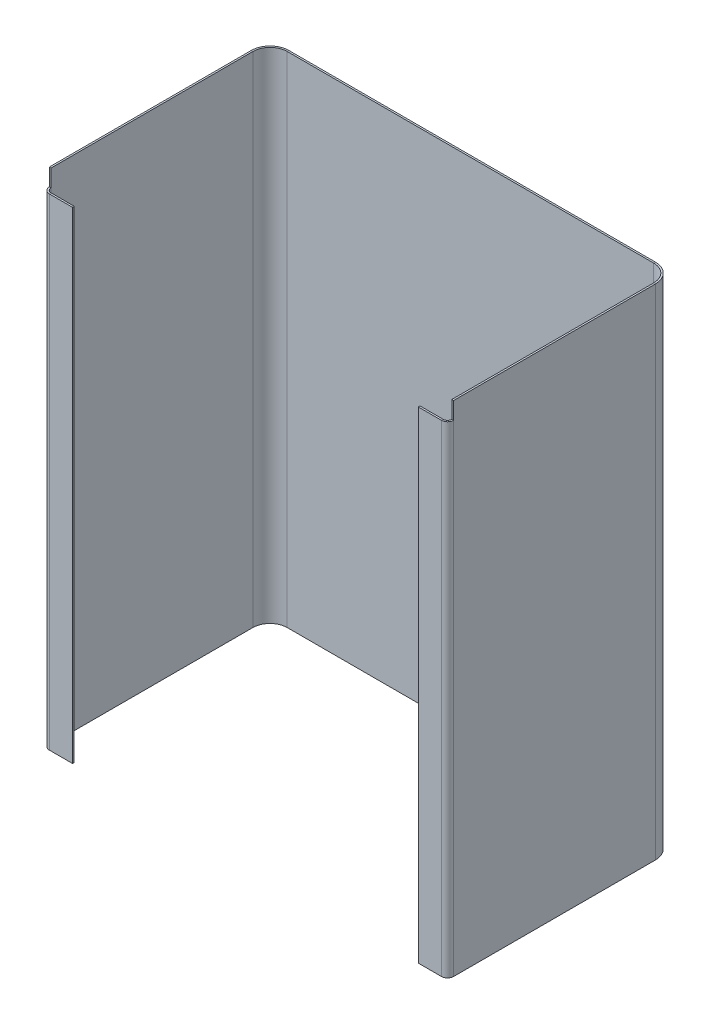
from build123d import *

# Parameters (mm, degrees)
SKETCH1_W                      = 235
SKETCH1_H                      = 1
BASE_FLANGE1_DEPTH             = 145
EDGE_FLANGE2_STRIP_W           = 24
EDGE_FLANGE2_STRIP_H           = 1
EDGE_FLANGE2_STRIP_CUT_DEPTH   = 290
EDGE_FLANGE2_STRIP_2_W         = 24
EDGE_FLANGE2_STRIP_2_H         = 1
EDGE_FLANGE2_STRIP_CUT_2_DEPTH = 290
EDGE_FLANGE2_DEPTH             = 290
EDGE_FLANGE2_BEND_DEPTH        = 290
EDGE_FLANGE3_STRIP_W           = 9
EDGE_FLANGE3_STRIP_H           = 1
EDGE_FLANGE3_STRIP_CUT_DEPTH   = 290
EDGE_FLANGE3_STRIP_2_W         = 9
EDGE_FLANGE3_STRIP_2_H         = 1
EDGE_FLANGE3_STRIP_CUT_2_DEPTH = 290
EDGE_FLANGE3_DEPTH             = 290
EDGE_FLANGE3_BEND_DEPTH        = 290
CUT_EXTRUDE1_START             = -10
CUT_EXTRUDE1_DEPTH             = 10


# Read off the part's stored shape, not the designer's step: Cut-Extrude1
# Sheet-metal steps are written as plain solids
with BuildPart() as part:
    # Sketch1 → Base-Flange1 (new, symmetric)
    with BuildSketch(Plane(origin=(0, 0, 0), x_dir=(1, 0, 0), z_dir=(0, 1, 0))):
        with Locations((0, -0.5)):
            Rectangle(SKETCH1_W, SKETCH1_H)
    extrude(amount=BASE_FLANGE1_DEPTH, both=True)

    # Edge-Flange2 strip (across the edge) → Edge-Flange2 strip cut (cut)
    with BuildSketch(Plane(origin=(-117.5, 145, 1), x_dir=(1, 0, 0), z_dir=(0, -1, 0))):
        with Locations((-1, -0.5)):
            Rectangle(EDGE_FLANGE2_STRIP_W, EDGE_FLANGE2_STRIP_H)
    extrude(amount=EDGE_FLANGE2_STRIP_CUT_DEPTH, mode=Mode.SUBTRACT)

    # Edge-Flange2 strip 2 (across the edge) → Edge-Flange2 strip cut 2 (cut)
    with BuildSketch(Plane(origin=(117.5, -145, 1), x_dir=(-1, 0, 0), z_dir=(0, 1, 0))):
        with Locations((-1, -0.5)):
            Rectangle(EDGE_FLANGE2_STRIP_2_W, EDGE_FLANGE2_STRIP_2_H)
    extrude(amount=EDGE_FLANGE2_STRIP_CUT_2_DEPTH, mode=Mode.SUBTRACT)

    # Edge-Flange2 section (across the edge) → Edge-Flange2 (add)
    with BuildSketch(Plane(origin=(-117.5, 145, 1), x_dir=(1, 0, 0), z_dir=(0, -1, 0))):
        with BuildLine():
            Line((0, 10), (0, 130.826439119))
            Line((0, 130.826439119), (1, 130.826439119))
            Line((1, 130.826439119), (1, 10))
            ThreePointArc((1, 10), (3.928932188, 2.928932188), (11, 0))
            Line((11, 0), (11, -1))
            ThreePointArc((11, -1), (3.221825407, 2.221825407), (0, 10))
        make_face()
    extrude(amount=EDGE_FLANGE2_DEPTH)

    # Edge-Flange2 section 2 (across the edge) → Edge-Flange2 bend (add)
    with BuildSketch(Plane(origin=(117.5, -145, 1), x_dir=(-1, 0, 0), z_dir=(0, 1, 0))):
        with BuildLine():
            Line((0, 10), (0, 130.826439119))
            Line((0, 130.826439119), (1, 130.826439119))
            Line((1, 130.826439119), (1, 10))
            ThreePointArc((1, 10), (3.928932188, 2.928932188), (11, 0))
            Line((11, 0), (11, -1))
            ThreePointArc((11, -1), (3.221825407, 2.221825407), (0, 10))
        make_face()
    extrude(amount=EDGE_FLANGE2_BEND_DEPTH)

    # Edge-Flange3 strip (across the edge) → Edge-Flange3 strip cut (cut)
    with BuildSketch(Plane(origin=(-116.5, 145, 131.826439119), x_dir=(0, 0, -1), z_dir=(0, -1, 0))):
        with Locations((-1, -0.5)):
            Rectangle(EDGE_FLANGE3_STRIP_W, EDGE_FLANGE3_STRIP_H)
    extrude(amount=EDGE_FLANGE3_STRIP_CUT_DEPTH, mode=Mode.SUBTRACT)

    # Edge-Flange3 strip 2 (across the edge) → Edge-Flange3 strip cut 2 (cut)
    with BuildSketch(Plane(origin=(116.5, -145, 131.826439119), x_dir=(0, 0, -1), z_dir=(0, 1, 0))):
        with Locations((-1, -0.5)):
            Rectangle(EDGE_FLANGE3_STRIP_2_W, EDGE_FLANGE3_STRIP_2_H)
    extrude(amount=EDGE_FLANGE3_STRIP_CUT_2_DEPTH, mode=Mode.SUBTRACT)

    # Edge-Flange3 section (across the edge) → Edge-Flange3 (add)
    with BuildSketch(Plane(origin=(-116.5, 145, 131.826439119), x_dir=(0, 0, -1), z_dir=(0, -1, 0))):
        with BuildLine():
            Line((0, 2.5), (0, 16))
            Line((0, 16), (1, 16))
            Line((1, 16), (1, 2.5))
            ThreePointArc((1, 2.5), (1.732233047, 0.732233047), (3.5, 0))
            Line((3.5, 0), (3.5, -1))
            ThreePointArc((3.5, -1), (1.025126266, 0.025126266), (0, 2.5))
        make_face()
    extrude(amount=EDGE_FLANGE3_DEPTH)

    # Edge-Flange3 section 2 (across the edge) → Edge-Flange3 bend (add)
    with BuildSketch(Plane(origin=(116.5, -145, 131.826439119), x_dir=(0, 0, -1), z_dir=(0, 1, 0))):
        with BuildLine():
            Line((0, 2.5), (0, 16))
            Line((0, 16), (1, 16))
            Line((1, 16), (1, 2.5))
            ThreePointArc((1, 2.5), (1.732233047, 0.732233047), (3.5, 0))
            Line((3.5, 0), (3.5, -1))
            ThreePointArc((3.5, -1), (1.025126266, 0.025126266), (0, 2.5))
        make_face()
    extrude(amount=EDGE_FLANGE3_BEND_DEPTH)

    # Cut-Extrude1 outline → Cut-Extrude1 (cut)
    with BuildSketch(Plane(origin=(0, 145, 0), x_dir=(1, 0, 0), z_dir=(0, 1, 0)).offset(CUT_EXTRUDE1_START)):
        with BuildLine():
            ThreePointArc((114, -131.826439119), (116.474873734, -130.801312853), (117.5, -128.326439119))
            Line((117.5, -128.326439119), (116.5, -128.326439119))
            ThreePointArc((116.5, -128.326439119), (115.767766953, -130.094206072), (114, -130.826439119))
            Line((114, -130.826439119), (100.5, -130.826439119))
            Line((100.5, -130.826439119), (100.5, -131.826439119))
            Line((100.5, -131.826439119), (114, -131.826439119))
        make_face()
        with BuildLine():
            ThreePointArc((-114, -130.826439119), (-115.767766953, -130.094206072), (-116.5, -128.326439119))
            Line((-116.5, -128.326439119), (-117.5, -128.326439119))
            ThreePointArc((-117.5, -128.326439119), (-116.474873734, -130.801312853), (-114, -131.826439119))
            Line((-114, -131.826439119), (-100.5, -131.826439119))
            Line((-100.5, -131.826439119), (-100.5, -130.826439119))
            Line((-100.5, -130.826439119), (-114, -130.826439119))
        make_face()
    extrude(amount=CUT_EXTRUDE1_DEPTH, mode=Mode.SUBTRACT)


solid = part.part
